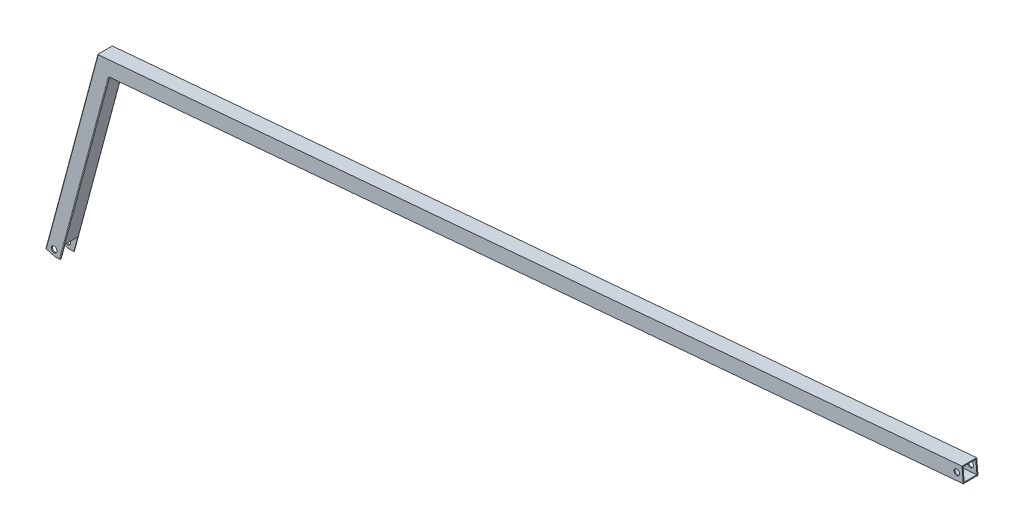
from build123d import *

# Parameters (mm, degrees)
SKETCH1_R           = 4.826
BOSS_EXTRUDE1_DEPTH = 12.7
SHELL1_T            = -1.651
FILLET1_R           = 1.27
CUT_EXTRUDE1_DEPTH  = 1687.967149857
SKETCH3_W           = 22.098
SKETCH3_H           = 25.4
CUT_EXTRUDE2_DEPTH  = 1687.15611004
FILLET2_R           = 1.27


with BuildPart() as part:
    # Sketch1 → Boss-Extrude1 (new, symmetric)
    with BuildSketch(Plane(origin=(0, 0, 0), x_dir=(-1, 0, 0), z_dir=(0, 0, -1))):
        Polygon((1525.824970161, -143.429725589), (32.8955398, -12.815324988), (30.681783934, -38.118670319), (1505.893621152, -167.182982375), (1591.032993411, -484.927445368), (1615.567509398, -478.353441623), align=None)
        with Locations((1600.835, -472.44)):
            Circle(SKETCH1_R, mode=Mode.SUBTRACT)
        with Locations((41.91, -26.3525)):
            Circle(SKETCH1_R, mode=Mode.SUBTRACT)
    extrude(amount=BOSS_EXTRUDE1_DEPTH, both=True)

    # Shell1
    shell1_openings = [part.faces().sort_by_distance(p)[0] for p in [
        (-31.788661867, -25.466997654, 0),
        (-1596.009, -472.44, 0),
        (-1603.300251405, -481.640443495, 0),
        (-37.084, -26.3525, 0),
    ]]
    offset(amount=SHELL1_T, openings=shell1_openings, kind=Kind.INTERSECTION)

    # Fillet1
    fillet1_edges = [part.edges().sort_by_distance(p)[0] for p in [
        (-1569.251099167, -311.877219573, -11.049),
        (-1569.251099167, -311.877219573, 11.049),
        (-1549.908447894, -325.069577904, -11.049),
        (-1549.908447894, -325.069577904, 11.049),
        (-1548.463307282, -326.055213872, 12.7),
        (-1570.69623978, -310.891583606, 12.7),
        (-1570.69623978, -310.891583606, -12.7),
        (-1548.463307282, -326.055213872, -12.7),
    ]]
    fillet(fillet1_edges, radius=FILLET1_R)

    # Sketch2 → Cut-Extrude1 (cut, through all)
    with BuildSketch(Plane(origin=(0, 0, -12.7), x_dir=(-1, 0, 0), z_dir=(0, 0, -1))):
        Polygon((1599.719137777, -482.6), (1590.409356304, -482.6), (1591.032993411, -484.927445368), align=None)
    extrude(amount=-CUT_EXTRUDE1_DEPTH, mode=Mode.SUBTRACT)

    # Sketch3 → Cut-Extrude2 (cut, through all)
    with BuildSketch(Plane(origin=(0, 0, 0), x_dir=(0, 0, -1), z_dir=(1, 0, 0))):
        with Locations((0, -469.9)):
            Rectangle(SKETCH3_W, SKETCH3_H)
    extrude(amount=-CUT_EXTRUDE2_DEPTH, mode=Mode.SUBTRACT)

    # Fillet2
    fillet2_edges = [part.edges().sort_by_distance(p)[0] for p in [
        (-1608.387440937, -457.2, -11.049),
        (-1585.115467678, -457.2, -11.049),
        (-1608.387440937, -457.2, 11.049),
        (-1585.115467678, -457.2, 11.049),
    ]]
    fillet(fillet2_edges, radius=FILLET2_R)


solid = part.part
